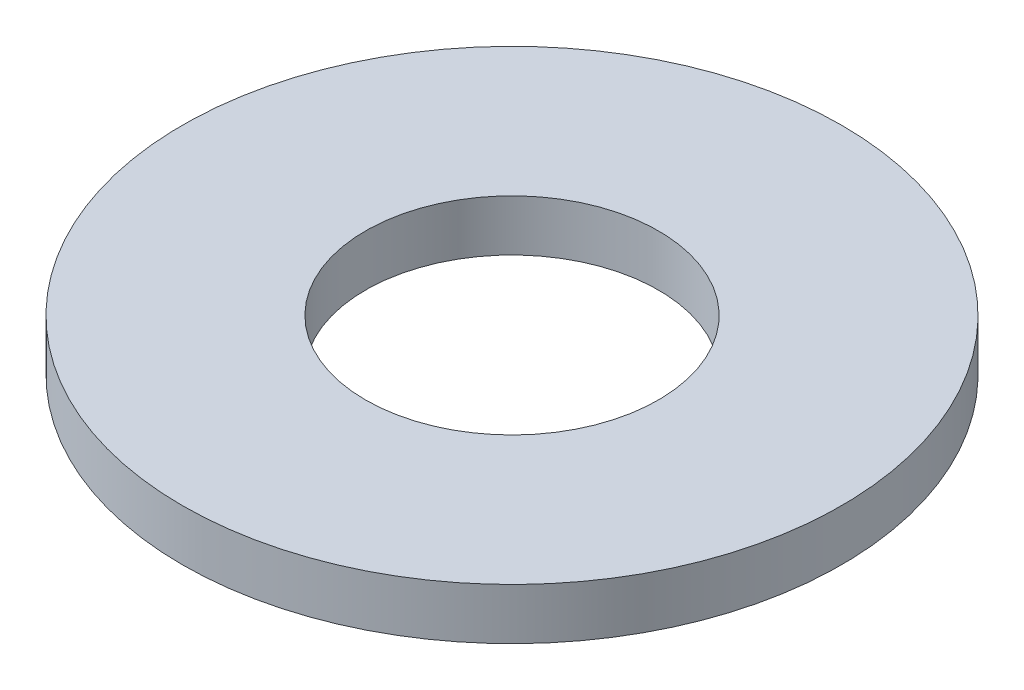
from build123d import *

# Parameters (mm, degrees)
SKETCH1_R           = 90
BOSS_EXTRUDE1_DEPTH = 14
SKETCH2_R           = 40
CUT_EXTRUDE1_DEPTH  = 129.04686642


with BuildPart() as part:
    # Sketch1 → Boss-Extrude1 (new body)
    with BuildSketch(Plane(origin=(0, 0, 0), x_dir=(1, 0, 0), z_dir=(0, 1, 0))):
        Circle(SKETCH1_R)
    extrude(amount=BOSS_EXTRUDE1_DEPTH)

    # Sketch2 → Cut-Extrude1 (cut, through all)
    with BuildSketch(Plane(origin=(0, 0, 0), x_dir=(1, 0, 0), z_dir=(0, 1, 0))):
        Circle(SKETCH2_R)
    extrude(amount=CUT_EXTRUDE1_DEPTH, mode=Mode.SUBTRACT)


solid = part.part
